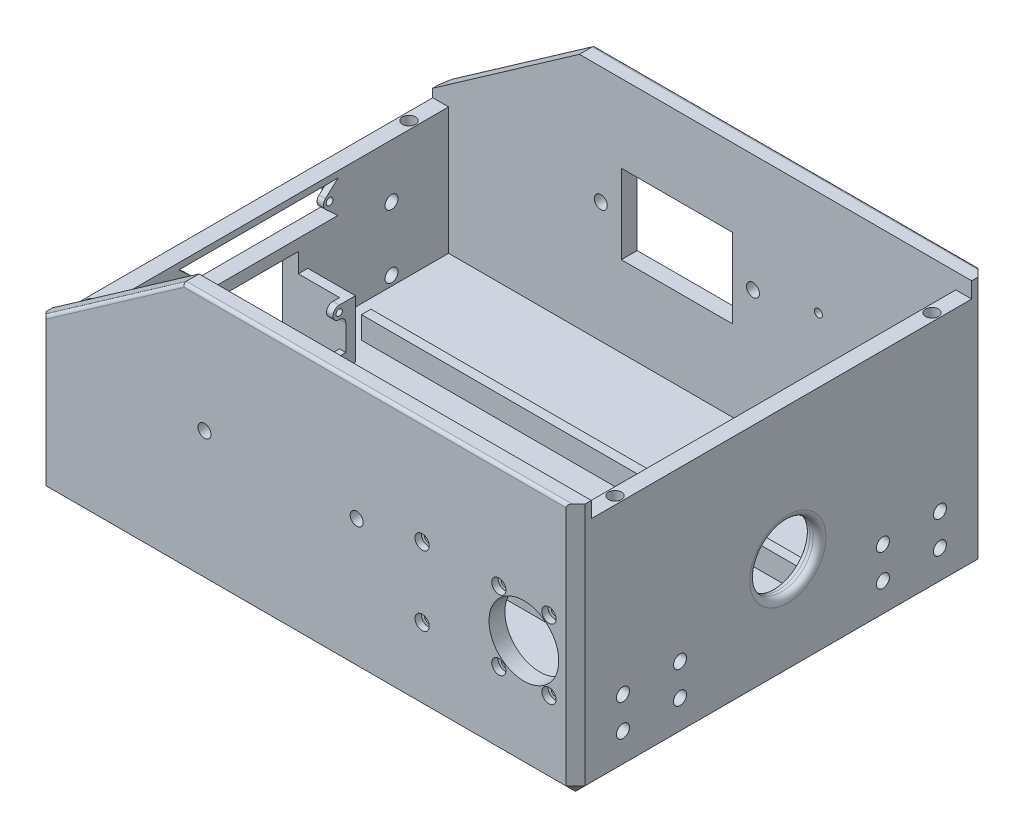
from build123d import *

# Parameters (mm, degrees)
BOSS_EXTRUDE1_DEPTH          = 60
BOSS_EXTRUDE2_START          = 60
SKETCH1_3_W                  = 5
SKETCH1_3_H                  = 5
BOSS_EXTRUDE2_DEPTH          = 5
BOSS_EXTRUDE4_START          = -60
SKETCH1_6_W                  = 5
SKETCH1_6_H                  = 5
BOSS_EXTRUDE4_DEPTH          = 5
FILLET1_SIZE                 = 3
FILLET2_R                    = 1
CUT_EXTRUDE1_START           = -65
CUT_EXTRUDE1_OUTLINE_R       = 1.25
CUT_EXTRUDE1_OUTLINE_R_2     = 11
CUT_EXTRUDE1_DEPTH           = 130
CUT_EXTRUDE6_START           = -73
SKETCH3_3_R                  = 2.25
SKETCH3_3_R_2                = 1.25
CUT_EXTRUDE6_DEPTH           = 10
CUT_EXTRUDE7_START           = 63
SKETCH3_4_R                  = 2.25
SKETCH3_4_R_2                = 1.25
CUT_EXTRUDE7_DEPTH           = 10
SKETCH5_R                    = 2.05
CUT_EXTRUDE3_DEPTH           = 6
SKETCH6_R                    = 2.05
CUT_EXTRUDE4_DEPTH           = 6
SKETCH10_R                   = 10
CUT_EXTRUDE9_DEPTH           = 10
FILLET4_R                    = 2
SKETCH11_R                   = 1
SKETCH11_R_2                 = 2.05
CUT_EXTRUDE10_DEPTH          = 10
SKETCH11_4_R                 = 1
CUT_EXTRUDE11_DEPTH          = 3
CUT_EXTRUDE14_DEPTH          = 193.54869514
CUT_EXTRUDE14_DEPTH_BACK     = 193.54869514
SKETCH12_R                   = 2.05
SKETCH12_3_W                 = 35
SKETCH12_3_H                 = 25
CUT_EXTRUDE15_DEPTH          = 193.54869514
CUT_EXTRUDE_NEW_CAMERA_DEPTH = 5
BOSS_EXTRUDE8_START          = -5
BOSS_EXTRUDE8_DEPTH          = 15
BOSS_EXTRUDE9_START          = -18
BOSS_EXTRUDE9_DEPTH          = 2
BOSS_EXTRUDE10_START         = -10
SKETCH13_W                   = 2
SKETCH13_H                   = 4
BOSS_EXTRUDE10_DEPTH         = 2
BOSS_EXTRUDE10_2_DEPTH       = 2
BOSS_EXTRUDE11_START         = -20
SKETCH13_4_W                 = 2
SKETCH13_4_H                 = 4
BOSS_EXTRUDE11_DEPTH         = 2
SKETCH11_10_R                = 1.1
CUT_EXTRUDE16_DEPTH          = 10
SKETCH11_11_R                = 2
SKETCH11_11_R_2              = 1.1
CUT_EXTRUDE17_DEPTH          = 3
BOSS_EXTRUDE12_DEPTH         = 7
BOSS_EXTRUDE13_START         = 5
SKETCH14_3_W                 = 4
SKETCH14_3_H                 = 2
BOSS_EXTRUDE13_DEPTH         = 2
SKETCH15_W                   = 36.014180311
SKETCH15_H                   = 76.937245795
CUT_EXTRUDE19_DEPTH          = 227.770809409
SKETCH16_R                   = 2.05
CUT_EXTRUDE20_DEPTH          = 10
SKETCH17_W                   = 140
SKETCH17_H                   = 34.5
CUT_EXTRUDE21_DEPTH          = 7
FILLET5_R                    = 2


# Read off the part's stored shape, not the designer's step: Cut-Extrude1
with BuildPart() as part:
    # Sketch1 → Boss-Extrude1 (new, symmetric)
    with BuildSketch(Plane.XY):
        Polygon((0, 0), (0, 40), (-5, 40), (-5, -5), (165, -5), (165, 70), (160, 70), (160, 0), align=None)
    extrude(amount=BOSS_EXTRUDE1_DEPTH, both=True)

    # Sketch1<3> → Boss-Extrude2 (add)
    with BuildSketch(Plane.XY.offset(BOSS_EXTRUDE2_START)):
        Polygon((0, 0), (0, 40), (-5, 40), (-5, -5), (165, -5), (165, 70), (160, 70), (160, 0), align=None)
        with Locations((162.5, 72.5)):
            Rectangle(SKETCH1_3_W, SKETCH1_3_H)
        Polygon((0, 40), (42.844440202, 70), (160, 70), (160, 0), (0, 0), align=None)
        Polygon((-5, 40), (0, 40), (42.844440202, 70), (160, 70), (160, 75), (41.267946258, 75), (-5, 42.602835253), align=None)
    extrude(amount=BOSS_EXTRUDE2_DEPTH)

    # Sketch1<6> → Boss-Extrude4 (add)
    with BuildSketch(Plane.XY.offset(BOSS_EXTRUDE4_START)):
        Polygon((0, 0), (0, 40), (-5, 40), (-5, -5), (165, -5), (165, 70), (160, 70), (160, 0), align=None)
        with Locations((162.5, 72.5)):
            Rectangle(SKETCH1_6_W, SKETCH1_6_H)
        Polygon((-5, 40), (0, 40), (42.844440202, 70), (160, 70), (160, 75), (41.267946258, 75), (-5, 42.602835253), align=None)
        Polygon((0, 40), (42.844440202, 70), (160, 70), (160, 0), (0, 0), align=None)
    extrude(amount=-BOSS_EXTRUDE4_DEPTH)

    # Fillet1
    fillet1_edges = [part.edges().sort_by_distance(p)[0] for p in [
        (165, -5, 0),
        (-5, -5, 0),
        (-5, 18.801417626, 65),
        (80, -5, 65),
        (165, 35, 65),
        (165, 35, -65),
        (80, -5, -65),
        (-5, 18.801417626, -65),
    ]]
    chamfer(fillet1_edges, length=FILLET1_SIZE)

    # Fillet2
    fillet2_edges = [part.edges().sort_by_distance(p)[0] for p in [
        (101.633973129, 75, -65),
        (19.633973129, 59.851728934, -65),
        (101.633973129, 75, 65),
        (19.633973129, 59.851728934, 65),
    ]]
    fillet(fillet2_edges, radius=FILLET2_R)

    # Cut-Extrude1 outline → Cut-Extrude1 (cut)
    with BuildSketch(Plane.XY.offset(CUT_EXTRUDE1_START)):
        with Locations((116.65, 42)):
            Circle(CUT_EXTRUDE1_OUTLINE_R)
        with Locations((116.65, 20)):
            Circle(CUT_EXTRUDE1_OUTLINE_R)
        with Locations((140.85, 20)):
            Circle(CUT_EXTRUDE1_OUTLINE_R)
        with Locations((140.85, 42)):
            Circle(CUT_EXTRUDE1_OUTLINE_R)
        with Locations((156.65, 42)):
            Circle(CUT_EXTRUDE1_OUTLINE_R)
        with Locations((148.75, 31)):
            Circle(CUT_EXTRUDE1_OUTLINE_R_2)
        with Locations((156.65, 20)):
            Circle(CUT_EXTRUDE1_OUTLINE_R)
    extrude(amount=CUT_EXTRUDE1_DEPTH, mode=Mode.SUBTRACT)

    # Sketch3<3> → Cut-Extrude6 (cut)
    # profile 1 of 6: a face of its own
    with BuildSketch(Plane.XY.offset(CUT_EXTRUDE6_START)):
        with Locations((156.65, 42)):
            Circle(SKETCH3_3_R)
        with Locations((156.65, 42)):
            Circle(SKETCH3_3_R_2, mode=Mode.SUBTRACT)
    # profile 2 of 6: a face of its own
    with BuildSketch(Plane.XY.offset(CUT_EXTRUDE6_START)):
        with Locations((116.65, 42)):
            Circle(SKETCH3_3_R)
        with Locations((116.65, 42)):
            Circle(SKETCH3_3_R_2, mode=Mode.SUBTRACT)
    # profile 3 of 6: a face of its own
    with BuildSketch(Plane.XY.offset(CUT_EXTRUDE6_START)):
        with Locations((140.85, 42)):
            Circle(SKETCH3_3_R)
        with Locations((140.85, 42)):
            Circle(SKETCH3_3_R_2, mode=Mode.SUBTRACT)
    # profile 4 of 6: a face of its own
    with BuildSketch(Plane.XY.offset(CUT_EXTRUDE6_START)):
        with Locations((116.65, 20)):
            Circle(SKETCH3_3_R)
        with Locations((116.65, 20)):
            Circle(SKETCH3_3_R_2, mode=Mode.SUBTRACT)
    # profile 5 of 6: a face of its own
    with BuildSketch(Plane.XY.offset(CUT_EXTRUDE6_START)):
        with Locations((140.85, 20)):
            Circle(SKETCH3_3_R)
        with Locations((140.85, 20)):
            Circle(SKETCH3_3_R_2, mode=Mode.SUBTRACT)
    # profile 6 of 6: a face of its own
    with BuildSketch(Plane.XY.offset(CUT_EXTRUDE6_START)):
        with Locations((156.65, 20)):
            Circle(SKETCH3_3_R)
        with Locations((156.65, 20)):
            Circle(SKETCH3_3_R_2, mode=Mode.SUBTRACT)
    extrude(amount=CUT_EXTRUDE6_DEPTH, mode=Mode.SUBTRACT)

    # Sketch3<4> → Cut-Extrude7 (cut)
    # profile 1 of 6: a face of its own
    with BuildSketch(Plane.XY.offset(CUT_EXTRUDE7_START)):
        with Locations((156.65, 42)):
            Circle(SKETCH3_4_R)
        with Locations((156.65, 42)):
            Circle(SKETCH3_4_R_2, mode=Mode.SUBTRACT)
    # profile 2 of 6: a face of its own
    with BuildSketch(Plane.XY.offset(CUT_EXTRUDE7_START)):
        with Locations((140.85, 42)):
            Circle(SKETCH3_4_R)
        with Locations((140.85, 42)):
            Circle(SKETCH3_4_R_2, mode=Mode.SUBTRACT)
    # profile 3 of 6: a face of its own
    with BuildSketch(Plane.XY.offset(CUT_EXTRUDE7_START)):
        with Locations((116.65, 42)):
            Circle(SKETCH3_4_R)
        with Locations((116.65, 42)):
            Circle(SKETCH3_4_R_2, mode=Mode.SUBTRACT)
    # profile 4 of 6: a face of its own
    with BuildSketch(Plane.XY.offset(CUT_EXTRUDE7_START)):
        with Locations((140.85, 20)):
            Circle(SKETCH3_4_R)
        with Locations((140.85, 20)):
            Circle(SKETCH3_4_R_2, mode=Mode.SUBTRACT)
    # profile 5 of 6: a face of its own
    with BuildSketch(Plane.XY.offset(CUT_EXTRUDE7_START)):
        with Locations((156.65, 20)):
            Circle(SKETCH3_4_R)
        with Locations((156.65, 20)):
            Circle(SKETCH3_4_R_2, mode=Mode.SUBTRACT)
    # profile 6 of 6: a face of its own
    with BuildSketch(Plane.XY.offset(CUT_EXTRUDE7_START)):
        with Locations((116.65, 20)):
            Circle(SKETCH3_4_R)
        with Locations((116.65, 20)):
            Circle(SKETCH3_4_R_2, mode=Mode.SUBTRACT)
    extrude(amount=CUT_EXTRUDE7_DEPTH, mode=Mode.SUBTRACT)

    # Sketch5 → Cut-Extrude3 (cut)
    with BuildSketch(Plane(origin=(0, 70, 0), x_dir=(1, 0, 0), z_dir=(0, 1, 0))):
        with Locations(Location((162.5, 50, 0), (0, 0, 270))):
            Circle(SKETCH5_R)
        with Locations(Location((162.5, -50, 0), (0, 0, 270))):
            Circle(SKETCH5_R)
    extrude(amount=-CUT_EXTRUDE3_DEPTH, mode=Mode.SUBTRACT)

    # Sketch6 → Cut-Extrude4 (cut)
    with BuildSketch(Plane(origin=(0, 40, 0), x_dir=(1, 0, 0), z_dir=(0, 1, 0))):
        with Locations(Location((-2.5, 50, 0), (0, 0, 270))):
            Circle(SKETCH6_R)
        with Locations(Location((-2.5, -50, 0), (0, 0, 270))):
            Circle(SKETCH6_R)
    extrude(amount=-CUT_EXTRUDE4_DEPTH, mode=Mode.SUBTRACT)

    # Sketch10 → Cut-Extrude9 (cut)
    with BuildSketch(Plane.ZY.offset(-160)):
        with Locations((-2, 28)):
            Circle(SKETCH10_R)
    extrude(amount=-CUT_EXTRUDE9_DEPTH, mode=Mode.SUBTRACT)

    # Fillet4
    fillet4_edges = [part.edges().sort_by_distance(p)[0] for p in [
        (165, 28, -12),
        (160, 28, -12),
    ]]
    fillet(fillet4_edges, radius=FILLET4_R)

    # Sketch11 → Cut-Extrude10 (cut)
    with BuildSketch(Plane.ZY.offset(5)):
        with BuildLine():
            Line((10.5, 18.1), (12.6, 18.1))
            Line((12.6, 18.1), (12.6, 24.2))
            Line((12.6, 24.2), (-12.6, 24.2))
            Line((-12.6, 24.2), (-12.6, 18.1))
            Line((-12.6, 18.1), (-10.5, 18.1))
            ThreePointArc((-10.5, 18.1), (-8.5, 16.1), (-10.5, 14.1))
            Line((-10.5, 14.1), (-12.6, 14.1))
            Line((-12.6, 14.1), (-12.6, 4.1))
            Line((-12.6, 4.1), (-10.5, 4.1))
            ThreePointArc((-10.5, 4.1), (-9.085786438, 3.514213562), (-8.5, 2.1))
            Line((-8.5, 2.1), (-8.5, 0))
            Line((-8.5, 0), (8.5, 0))
            Line((8.5, 0), (8.5, 2.1))
            ThreePointArc((8.5, 2.1), (9.085786438, 3.514213562), (10.5, 4.1))
            Line((10.5, 4.1), (12.6, 4.1))
            Line((12.6, 4.1), (12.6, 14.1))
            Line((12.6, 14.1), (10.5, 14.1))
            ThreePointArc((10.5, 14.1), (8.5, 16.1), (10.5, 18.1))
        make_face()
        with Locations((10.5, 16.1)):
            Circle(SKETCH11_R)
        with Locations((-10.5, 16.1)):
            Circle(SKETCH11_R)
        with Locations((10.5, 2.1)):
            Circle(SKETCH11_R)
        with Locations((-10.5, 2.1)):
            Circle(SKETCH11_R)
        with BuildLine():
            Line((37, 23.6), (36.039770422, 23.6))
            ThreePointArc((36.039770422, 23.6), (35.950452624, 23.043076116), (36.016291722, 22.482891241))
            ThreePointArc((36.016291722, 22.482891241), (36.322770625, 22.060014306), (36.523500595, 21.577871487))
            ThreePointArc((36.523500595, 21.577871487), (36.748196295, 21.376581544), (37, 21.210446983))
            Line((37, 21.210446983), (37, 23.6))
        make_face()
        with BuildLine():
            ThreePointArc((37, 1.210446983), (40.05, 3), (37, 4.789553017))
            Line((37, 4.789553017), (37, 1.210446983))
        make_face()
        with Locations((-42, 23)):
            Circle(SKETCH11_R_2)
        with Locations((-42, 3)):
            Circle(SKETCH11_R_2)
    extrude(amount=-CUT_EXTRUDE10_DEPTH, mode=Mode.SUBTRACT)

    # Sketch11<4> → Cut-Extrude11 (cut)
    # profile 1 of 4: a face of its own
    with BuildSketch(Plane.ZY.offset(5)):
        with BuildLine():
            Line((12.6, 18.1), (10.5, 18.1))
            ThreePointArc((10.5, 18.1), (8.5, 16.1), (10.5, 14.1))
            Line((10.5, 14.1), (12.6, 14.1))
            Line((12.6, 14.1), (12.6, 18.1))
        make_face()
        with Locations((10.5, 16.1)):
            Circle(SKETCH11_4_R, mode=Mode.SUBTRACT)
    # profile 2 of 4: a face of its own
    with BuildSketch(Plane.ZY.offset(5)):
        with BuildLine():
            Line((-10.5, 18.1), (-12.6, 18.1))
            Line((-12.6, 18.1), (-12.6, 14.1))
            Line((-12.6, 14.1), (-10.5, 14.1))
            ThreePointArc((-10.5, 14.1), (-8.5, 16.1), (-10.5, 18.1))
        make_face()
        with Locations((-10.5, 16.1)):
            Circle(SKETCH11_4_R, mode=Mode.SUBTRACT)
    # profile 3 of 4: a face of its own
    with BuildSketch(Plane.ZY.offset(5)):
        with BuildLine():
            Line((12.6, 0), (12.6, 4.1))
            Line((12.6, 4.1), (10.5, 4.1))
            ThreePointArc((10.5, 4.1), (9.085786438, 3.514213562), (8.5, 2.1))
            Line((8.5, 2.1), (8.5, 0))
            Line((8.5, 0), (12.6, 0))
        make_face()
        with Locations((10.5, 2.1)):
            Circle(SKETCH11_4_R, mode=Mode.SUBTRACT)
    # profile 4 of 4: a face of its own
    with BuildSketch(Plane.ZY.offset(5)):
        with BuildLine():
            ThreePointArc((-8.5, 2.1), (-9.085786438, 3.514213562), (-10.5, 4.1))
            Line((-10.5, 4.1), (-12.6, 4.1))
            Line((-12.6, 4.1), (-12.6, 0))
            Line((-12.6, 0), (-8.5, 0))
            Line((-8.5, 0), (-8.5, 2.1))
        make_face()
        with Locations((-10.5, 2.1)):
            Circle(SKETCH11_4_R, mode=Mode.SUBTRACT)
    extrude(amount=-CUT_EXTRUDE11_DEPTH, mode=Mode.SUBTRACT)

    # Sketch12 → Cut-Extrude14 (cut, two sides: drawn at the far end of the back side and taken through both)
    with BuildSketch(Plane.XY.offset(-CUT_EXTRUDE14_DEPTH_BACK)):
        with Locations((48, 38)):
            Circle(SKETCH12_R)
        with Locations((96, 38)):
            Circle(SKETCH12_R)
    extrude(amount=CUT_EXTRUDE14_DEPTH + CUT_EXTRUDE14_DEPTH_BACK, mode=Mode.SUBTRACT)

    # Sketch12<3> → Cut-Extrude15 (cut, through all)
    with BuildSketch(Plane.XY):
        with Locations((72, 38)):
            Rectangle(SKETCH12_3_W, SKETCH12_3_H)
    extrude(amount=-CUT_EXTRUDE15_DEPTH, mode=Mode.SUBTRACT)

    # Sketch11<7> → Cut-Extrude_new camera (cut)
    with BuildSketch(Plane.ZY.offset(5)):
        with BuildLine():
            ThreePointArc((12.5, 16.1), (11.914213562, 17.514213562), (10.5, 18.1))
            ThreePointArc((10.5, 18.1), (9.085786438, 17.514213562), (8.5, 16.1))
            Line((8.5, 16.1), (9.5, 16.1))
            ThreePointArc((9.5, 16.1), (10.5, 17.1), (11.5, 16.1))
            ThreePointArc((11.5, 16.1), (11.207106781, 15.392893219), (10.5, 15.1))
            Line((10.5, 15.1), (10.5, 14.1))
            ThreePointArc((10.5, 14.1), (11.914213562, 14.685786438), (12.5, 16.1))
        make_face()
        with BuildLine():
            Line((9.5, 16.1), (8.5, 16.1))
            ThreePointArc((8.5, 16.1), (9.085786438, 14.685786438), (10.5, 14.1))
            Line((10.5, 14.1), (10.5, 15.1))
            ThreePointArc((10.5, 15.1), (9.792893219, 15.392893219), (9.5, 16.1))
        make_face()
        with BuildLine():
            Line((12.6, 18.1), (10.5, 18.1))
            ThreePointArc((10.5, 18.1), (11.914213562, 17.514213562), (12.5, 16.1))
            ThreePointArc((12.5, 16.1), (11.914213562, 14.685786438), (10.5, 14.1))
            Line((10.5, 14.1), (12.6, 14.1))
            Line((12.6, 14.1), (12.6, 18.1))
        make_face()
        with BuildLine():
            ThreePointArc((-10.5, 14.1), (-9.085786438, 14.685786438), (-8.5, 16.1))
            Line((-8.5, 16.1), (-9.5, 16.1))
            ThreePointArc((-9.5, 16.1), (-9.792893219, 15.392893219), (-10.5, 15.1))
            Line((-10.5, 15.1), (-10.5, 14.1))
        make_face()
        with BuildLine():
            Line((-9.5, 16.1), (-8.5, 16.1))
            ThreePointArc((-8.5, 16.1), (-9.085786438, 17.514213562), (-10.5, 18.1))
            ThreePointArc((-10.5, 18.1), (-12.5, 16.1), (-10.5, 14.1))
            Line((-10.5, 14.1), (-10.5, 15.1))
            ThreePointArc((-10.5, 15.1), (-11.207106781, 16.807106781), (-9.5, 16.1))
        make_face()
        with BuildLine():
            ThreePointArc((-10.5, 14.1), (-12.5, 16.1), (-10.5, 18.1))
            Line((-10.5, 18.1), (-12.6, 18.1))
            Line((-12.6, 18.1), (-12.6, 14.1))
            Line((-12.6, 14.1), (-10.5, 14.1))
        make_face()
        with BuildLine():
            ThreePointArc((-8.5, 2.1), (-11.914213562, 0.685786438), (-10.5, 4.1))
            Line((-10.5, 4.1), (-12.6, 4.1))
            Line((-12.6, 4.1), (-12.6, 0))
            Line((-12.6, 0), (-8.5, 0))
            Line((-8.5, 0), (-8.5, 2.1))
        make_face()
        with BuildLine():
            ThreePointArc((-8.5, 2.1), (-9.085786438, 3.514213562), (-10.5, 4.1))
            Line((-10.5, 4.1), (-10.5, 3.1))
            ThreePointArc((-10.5, 3.1), (-9.792893219, 2.807106781), (-9.5, 2.1))
            Line((-9.5, 2.1), (-8.5, 2.1))
        make_face()
        with BuildLine():
            Line((-10.5, 3.1), (-10.5, 4.1))
            ThreePointArc((-10.5, 4.1), (-11.914213562, 0.685786438), (-8.5, 2.1))
            Line((-8.5, 2.1), (-9.5, 2.1))
            ThreePointArc((-9.5, 2.1), (-11.207106781, 1.392893219), (-10.5, 3.1))
        make_face()
        with BuildLine():
            ThreePointArc((12.5, 2.1), (11.914213562, 3.514213562), (10.5, 4.1))
            Line((10.5, 4.1), (10.5, 3.1))
            ThreePointArc((10.5, 3.1), (11.207106781, 2.807106781), (11.5, 2.1))
            ThreePointArc((11.5, 2.1), (10.5, 1.1), (9.5, 2.1))
            Line((9.5, 2.1), (8.5, 2.1))
            ThreePointArc((8.5, 2.1), (10.5, 0.1), (12.5, 2.1))
        make_face()
        with BuildLine():
            Line((10.5, 3.1), (10.5, 4.1))
            ThreePointArc((10.5, 4.1), (9.085786438, 3.514213562), (8.5, 2.1))
            Line((8.5, 2.1), (9.5, 2.1))
            ThreePointArc((9.5, 2.1), (9.792893219, 2.807106781), (10.5, 3.1))
        make_face()
        with BuildLine():
            Line((12.6, 0), (12.6, 4.1))
            Line((12.6, 4.1), (10.5, 4.1))
            ThreePointArc((10.5, 4.1), (11.914213562, 3.514213562), (12.5, 2.1))
            ThreePointArc((12.5, 2.1), (10.5, 0.1), (8.5, 2.1))
            Line((8.5, 2.1), (8.5, 0))
            Line((8.5, 0), (12.6, 0))
        make_face()
    extrude(amount=-CUT_EXTRUDE_NEW_CAMERA_DEPTH, mode=Mode.SUBTRACT)

    # Sketch11<8> → Boss-Extrude8 (add)
    with BuildSketch(Plane.ZY.offset(5).offset(BOSS_EXTRUDE8_START)):
        Polygon((15.6, 18.1), (12.6, 18.1), (12.6, 14.1), (12.6, 4.1), (12.6, 0), (15.6, 0), align=None)
        Polygon((-12.6, 14.1), (-12.6, 18.1), (-15.6, 18.1), (-15.6, 0), (-12.6, 0), (-12.6, 4.1), align=None)
    extrude(amount=-BOSS_EXTRUDE8_DEPTH)

    # Sketch11<9> → Boss-Extrude9 (add)
    with BuildSketch(Plane.ZY.offset(5).offset(BOSS_EXTRUDE9_START)):
        with BuildLine():
            ThreePointArc((12.5, 16.1), (11.914213562, 17.514213562), (10.5, 18.1))
            ThreePointArc((10.5, 18.1), (9.085786438, 17.514213562), (8.5, 16.1))
            Line((8.5, 16.1), (9.5, 16.1))
            ThreePointArc((9.5, 16.1), (10.5, 17.1), (11.5, 16.1))
            ThreePointArc((11.5, 16.1), (11.207106781, 15.392893219), (10.5, 15.1))
            Line((10.5, 15.1), (10.5, 14.1))
            ThreePointArc((10.5, 14.1), (11.914213562, 14.685786438), (12.5, 16.1))
        make_face()
        with BuildLine():
            Line((9.5, 16.1), (8.5, 16.1))
            ThreePointArc((8.5, 16.1), (9.085786438, 14.685786438), (10.5, 14.1))
            Line((10.5, 14.1), (10.5, 15.1))
            ThreePointArc((10.5, 15.1), (9.792893219, 15.392893219), (9.5, 16.1))
        make_face()
        with BuildLine():
            Line((12.6, 18.1), (10.5, 18.1))
            ThreePointArc((10.5, 18.1), (11.914213562, 17.514213562), (12.5, 16.1))
            ThreePointArc((12.5, 16.1), (11.914213562, 14.685786438), (10.5, 14.1))
            Line((10.5, 14.1), (12.6, 14.1))
            Line((12.6, 14.1), (12.6, 18.1))
        make_face()
        with BuildLine():
            ThreePointArc((-10.5, 14.1), (-12.5, 16.1), (-10.5, 18.1))
            Line((-10.5, 18.1), (-12.6, 18.1))
            Line((-12.6, 18.1), (-12.6, 14.1))
            Line((-12.6, 14.1), (-10.5, 14.1))
        make_face()
        with BuildLine():
            ThreePointArc((-10.5, 14.1), (-9.085786438, 14.685786438), (-8.5, 16.1))
            Line((-8.5, 16.1), (-9.5, 16.1))
            ThreePointArc((-9.5, 16.1), (-9.792893219, 15.392893219), (-10.5, 15.1))
            Line((-10.5, 15.1), (-10.5, 14.1))
        make_face()
        with BuildLine():
            Line((-9.5, 16.1), (-8.5, 16.1))
            ThreePointArc((-8.5, 16.1), (-9.085786438, 17.514213562), (-10.5, 18.1))
            ThreePointArc((-10.5, 18.1), (-12.5, 16.1), (-10.5, 14.1))
            Line((-10.5, 14.1), (-10.5, 15.1))
            ThreePointArc((-10.5, 15.1), (-11.207106781, 16.807106781), (-9.5, 16.1))
        make_face()
        with BuildLine():
            ThreePointArc((-8.5, 2.1), (-9.085786438, 3.514213562), (-10.5, 4.1))
            Line((-10.5, 4.1), (-10.5, 3.1))
            ThreePointArc((-10.5, 3.1), (-9.792893219, 2.807106781), (-9.5, 2.1))
            Line((-9.5, 2.1), (-8.5, 2.1))
        make_face()
        with BuildLine():
            Line((-10.5, 3.1), (-10.5, 4.1))
            ThreePointArc((-10.5, 4.1), (-11.914213562, 0.685786438), (-8.5, 2.1))
            Line((-8.5, 2.1), (-9.5, 2.1))
            ThreePointArc((-9.5, 2.1), (-11.207106781, 1.392893219), (-10.5, 3.1))
        make_face()
        with BuildLine():
            ThreePointArc((-8.5, 2.1), (-11.914213562, 0.685786438), (-10.5, 4.1))
            Line((-10.5, 4.1), (-12.6, 4.1))
            Line((-12.6, 4.1), (-12.6, 0))
            Line((-12.6, 0), (-8.5, 0))
            Line((-8.5, 0), (-8.5, 2.1))
        make_face()
        with BuildLine():
            Line((12.6, 0), (12.6, 4.1))
            Line((12.6, 4.1), (10.5, 4.1))
            ThreePointArc((10.5, 4.1), (11.914213562, 3.514213562), (12.5, 2.1))
            ThreePointArc((12.5, 2.1), (10.5, 0.1), (8.5, 2.1))
            Line((8.5, 2.1), (8.5, 0))
            Line((8.5, 0), (12.6, 0))
        make_face()
        with BuildLine():
            ThreePointArc((12.5, 2.1), (11.914213562, 3.514213562), (10.5, 4.1))
            Line((10.5, 4.1), (10.5, 3.1))
            ThreePointArc((10.5, 3.1), (11.207106781, 2.807106781), (11.5, 2.1))
            ThreePointArc((11.5, 2.1), (10.5, 1.1), (9.5, 2.1))
            Line((9.5, 2.1), (8.5, 2.1))
            ThreePointArc((8.5, 2.1), (10.5, 0.1), (12.5, 2.1))
        make_face()
        with BuildLine():
            Line((10.5, 3.1), (10.5, 4.1))
            ThreePointArc((10.5, 4.1), (9.085786438, 3.514213562), (8.5, 2.1))
            Line((8.5, 2.1), (9.5, 2.1))
            ThreePointArc((9.5, 2.1), (9.792893219, 2.807106781), (10.5, 3.1))
        make_face()
    extrude(amount=-BOSS_EXTRUDE9_DEPTH)

    # Sketch13<4> → Boss-Extrude11 (add)
    # profile 1 of 2: a face of its own
    with BuildSketch(Plane.XZ.offset(5).offset(BOSS_EXTRUDE11_START)):
        Polygon((170, -44.113248654), (165, -41.226497308), (165, -52), (170, -49.113248654), align=None)
        with Locations((167.5, -46.613248654)):
            Rectangle(SKETCH13_4_W, SKETCH13_4_H, mode=Mode.SUBTRACT)
    # profile 2 of 2: a face of its own
    with BuildSketch(Plane.XZ.offset(5).offset(BOSS_EXTRUDE11_START)):
        Polygon((170, 49.113248654), (165, 52), (165, 41.226497308), (170, 44.113248654), align=None)
        with Locations((167.5, 46.613248654)):
            Rectangle(SKETCH13_4_W, SKETCH13_4_H, mode=Mode.SUBTRACT)
    extrude(amount=-BOSS_EXTRUDE11_DEPTH)

    # Sketch11<10> → Cut-Extrude16 (cut)
    with BuildSketch(Plane.ZY.offset(5)):
        with BuildLine():
            Line((-21.147835618, 31.42634757), (-25.1, 27.8))
            Line((-25.1, 27.8), (25.1, 27.8))
            Line((25.1, 27.8), (21.147835618, 31.42634757))
            ThreePointArc((21.147835618, 31.42634757), (20.5, 32.9), (21.147835618, 34.37365243))
            Line((21.147835618, 34.37365243), (25.1, 38))
            Line((25.1, 38), (-25.1, 38))
            Line((-25.1, 38), (-21.147835618, 34.37365243))
            ThreePointArc((-21.147835618, 34.37365243), (-20.66910831, 33.704882363), (-20.5, 32.9))
            ThreePointArc((-20.5, 32.9), (-20.66910831, 32.095117637), (-21.147835618, 31.42634757))
        make_face()
        with Locations((-22.5, 32.9)):
            Circle(SKETCH11_10_R)
        with Locations((22.5, 32.9)):
            Circle(SKETCH11_10_R)
    extrude(amount=-CUT_EXTRUDE16_DEPTH, mode=Mode.SUBTRACT)

    # Sketch11<11> → Cut-Extrude17 (cut)
    # profile 1 of 4: a face of its own
    with BuildSketch(Plane.ZY.offset(5)):
        with BuildLine():
            Line((-25.1, 38), (-25.1, 27.8))
            Line((-25.1, 27.8), (-21.147835618, 31.42634757))
            ThreePointArc((-21.147835618, 31.42634757), (-24.5, 32.9), (-21.147835618, 34.37365243))
            Line((-21.147835618, 34.37365243), (-25.1, 38))
        make_face()
    # profile 2 of 4: a face of its own
    with BuildSketch(Plane.ZY.offset(5)):
        with Locations((-22.5, 32.9)):
            Circle(SKETCH11_11_R)
        with Locations((-22.5, 32.9)):
            Circle(SKETCH11_11_R_2, mode=Mode.SUBTRACT)
    # profile 3 of 4: a face of its own
    with BuildSketch(Plane.ZY.offset(5)):
        with BuildLine():
            Line((21.147835618, 31.42634757), (25.1, 27.8))
            Line((25.1, 27.8), (25.1, 38))
            Line((25.1, 38), (21.147835618, 34.37365243))
            ThreePointArc((21.147835618, 34.37365243), (23.304882363, 34.73089169), (24.5, 32.9))
            ThreePointArc((24.5, 32.9), (23.304882363, 31.06910831), (21.147835618, 31.42634757))
        make_face()
    # profile 4 of 4: a face of its own
    with BuildSketch(Plane.ZY.offset(5)):
        with Locations((22.5, 32.9)):
            Circle(SKETCH11_11_R)
        with Locations((22.5, 32.9)):
            Circle(SKETCH11_11_R_2, mode=Mode.SUBTRACT)
    extrude(amount=-CUT_EXTRUDE17_DEPTH, mode=Mode.SUBTRACT)

    # Sketch14 → Boss-Extrude12 (add)
    with BuildSketch(Plane(origin=(0, 0, 0), x_dir=(1, 0, 0), z_dir=(0, 1, 0))):
        Polygon((10, 25.5), (10, 22.5), (150, 22.5), (150, 25.5), (133.894010768, 25.5), (123.120508076, 25.5), (104.520508076, 25.5), (93.747005384, 25.5), (75.147005384, 25.5), (64.373502692, 25.5), (45.773502692, 25.5), (35, 25.5), align=None)
        Polygon((150, -22.5), (10, -22.5), (10, -25.5), (35, -25.5), (45.773502692, -25.5), (64.373502692, -25.5), (75.147005384, -25.5), (93.747005384, -25.5), (104.520508076, -25.5), (123.120508076, -25.5), (133.894010768, -25.5), (150, -25.5), align=None)
    extrude(amount=BOSS_EXTRUDE12_DEPTH)

    # Sketch14<3> → Boss-Extrude13 (add)
    # profile 1 of 8: a face of its own
    with BuildSketch(Plane(origin=(0, 0, 0), x_dir=(1, 0, 0), z_dir=(0, 1, 0)).offset(BOSS_EXTRUDE13_START)):
        Polygon((37.886751346, 30.5), (35, 25.5), (45.773502692, 25.5), (42.886751346, 30.5), align=None)
        with Locations((40.386751346, 28)):
            Rectangle(SKETCH14_3_W, SKETCH14_3_H, mode=Mode.SUBTRACT)
    # profile 2 of 8: a face of its own
    with BuildSketch(Plane(origin=(0, 0, 0), x_dir=(1, 0, 0), z_dir=(0, 1, 0)).offset(BOSS_EXTRUDE13_START)):
        Polygon((67.260254038, 30.5), (64.373502692, 25.5), (75.147005384, 25.5), (72.260254038, 30.5), align=None)
        with Locations((69.760254038, 28)):
            Rectangle(SKETCH14_3_W, SKETCH14_3_H, mode=Mode.SUBTRACT)
    # profile 3 of 8: a face of its own
    with BuildSketch(Plane(origin=(0, 0, 0), x_dir=(1, 0, 0), z_dir=(0, 1, 0)).offset(BOSS_EXTRUDE13_START)):
        Polygon((93.747005384, 25.5), (104.520508076, 25.5), (101.63375673, 30.5), (96.63375673, 30.5), align=None)
        with Locations((99.13375673, 28)):
            Rectangle(SKETCH14_3_W, SKETCH14_3_H, mode=Mode.SUBTRACT)
    # profile 4 of 8: a face of its own
    with BuildSketch(Plane(origin=(0, 0, 0), x_dir=(1, 0, 0), z_dir=(0, 1, 0)).offset(BOSS_EXTRUDE13_START)):
        Polygon((123.120508076, 25.5), (133.894010768, 25.5), (131.007259422, 30.5), (126.007259422, 30.5), align=None)
        with Locations((128.507259422, 28)):
            Rectangle(SKETCH14_3_W, SKETCH14_3_H, mode=Mode.SUBTRACT)
    # profile 5 of 8: a face of its own
    with BuildSketch(Plane(origin=(0, 0, 0), x_dir=(1, 0, 0), z_dir=(0, 1, 0)).offset(BOSS_EXTRUDE13_START)):
        Polygon((101.63375673, -30.5), (104.520508076, -25.5), (93.747005384, -25.5), (96.63375673, -30.5), align=None)
        with Locations((99.13375673, -28)):
            Rectangle(SKETCH14_3_W, SKETCH14_3_H, mode=Mode.SUBTRACT)
    # profile 6 of 8: a face of its own
    with BuildSketch(Plane(origin=(0, 0, 0), x_dir=(1, 0, 0), z_dir=(0, 1, 0)).offset(BOSS_EXTRUDE13_START)):
        Polygon((75.147005384, -25.5), (64.373502692, -25.5), (67.260254038, -30.5), (72.260254038, -30.5), align=None)
        with Locations((69.760254038, -28)):
            Rectangle(SKETCH14_3_W, SKETCH14_3_H, mode=Mode.SUBTRACT)
    # profile 7 of 8: a face of its own
    with BuildSketch(Plane(origin=(0, 0, 0), x_dir=(1, 0, 0), z_dir=(0, 1, 0)).offset(BOSS_EXTRUDE13_START)):
        Polygon((45.773502692, -25.5), (35, -25.5), (37.886751346, -30.5), (42.886751346, -30.5), align=None)
        with Locations((40.386751346, -28)):
            Rectangle(SKETCH14_3_W, SKETCH14_3_H, mode=Mode.SUBTRACT)
    # profile 8 of 8: a face of its own
    with BuildSketch(Plane(origin=(0, 0, 0), x_dir=(1, 0, 0), z_dir=(0, 1, 0)).offset(BOSS_EXTRUDE13_START)):
        Polygon((131.007259422, -30.5), (133.894010768, -25.5), (123.120508076, -25.5), (126.007259422, -30.5), align=None)
        with Locations((128.507259422, -28)):
            Rectangle(SKETCH14_3_W, SKETCH14_3_H, mode=Mode.SUBTRACT)
    extrude(amount=BOSS_EXTRUDE13_DEPTH)


with BuildPart() as body_2:
    # Sketch13 → Boss-Extrude10 (new body)
    with BuildSketch(Plane.XZ.offset(5).offset(BOSS_EXTRUDE10_START)):
        Polygon((170, -44.113248654), (165, -41.226497308), (165, -52), (170, -49.113248654), align=None)
        with Locations((167.5, -46.613248654)):
            Rectangle(SKETCH13_W, SKETCH13_H, mode=Mode.SUBTRACT)
    extrude(amount=-BOSS_EXTRUDE10_DEPTH)


with BuildPart() as body_3:
    # Sketch13 → Boss-Extrude10 2 (new body)
    with BuildSketch(Plane.XZ.offset(5).offset(BOSS_EXTRUDE10_START)):
        Polygon((170, 49.113248654), (165, 52), (165, 41.226497308), (170, 44.113248654), align=None)
        with Locations((167.5, 46.613248654)):
            Rectangle(SKETCH13_W, SKETCH13_H, mode=Mode.SUBTRACT)
    extrude(amount=-BOSS_EXTRUDE10_2_DEPTH)


with BuildPart() as cut_extrude19_tool:
    # Sketch15 → Cut-Extrude19 (new, through all)
    with BuildSketch(Plane.XY.offset(65)):
        with Locations((183.007090156, 36.531377103)):
            Rectangle(SKETCH15_W, SKETCH15_H)
    extrude(amount=-CUT_EXTRUDE19_DEPTH)


with BuildPart() as part_1:
    add(part.part)

    # Cut-Extrude19: cut by cut_extrude19_tool
    add(cut_extrude19_tool.part, mode=Mode.SUBTRACT)

    # Sketch16 → Cut-Extrude20 (cut)
    with BuildSketch(Plane(origin=(165, 0, 0), x_dir=(0, 0, -1), z_dir=(1, 0, 0))):
        with Locations((-50, 17)):
            Circle(SKETCH16_R)
        with Locations((-32, 17)):
            Circle(SKETCH16_R)
        with Locations((-32, 7)):
            Circle(SKETCH16_R)
        with Locations((-50, 7)):
            Circle(SKETCH16_R)
        with Locations(Location((50, 7, 0), (0, 0, 180))):
            Circle(SKETCH16_R)
        with Locations(Location((32, 7, 0), (0, 0, 180))):
            Circle(SKETCH16_R)
        with Locations(Location((32, 17, 0), (0, 0, 180))):
            Circle(SKETCH16_R)
        with Locations(Location((50, 17, 0), (0, 0, 180))):
            Circle(SKETCH16_R)
    extrude(amount=-CUT_EXTRUDE20_DEPTH, mode=Mode.SUBTRACT)

    # Sketch17 → Cut-Extrude21 (cut)
    with BuildSketch(Plane(origin=(0, 7, 0), x_dir=(1, 0, 0), z_dir=(0, 1, 0))):
        with Locations((80, 42.75)):
            Rectangle(SKETCH17_W, SKETCH17_H)
        with Locations((80, -42.75)):
            Rectangle(SKETCH17_W, SKETCH17_H)
    extrude(amount=-CUT_EXTRUDE21_DEPTH, mode=Mode.SUBTRACT)

    # Fillet5
    fillet5_edges = [part_1.edges().sort_by_distance(p)[0] for p in [
        (14, 14.1, 12.6),
        (14, 14.1, -12.6),
    ]]
    fillet(fillet5_edges, radius=FILLET5_R)


with BuildPart() as body_2_1:
    add(body_2.part)

    # Cut-Extrude19: cut by cut_extrude19_tool
    add(cut_extrude19_tool.part, mode=Mode.SUBTRACT)


with BuildPart() as body_3_1:
    add(body_3.part)

    # Cut-Extrude19: cut by cut_extrude19_tool
    add(cut_extrude19_tool.part, mode=Mode.SUBTRACT)


solid = part_1.part
